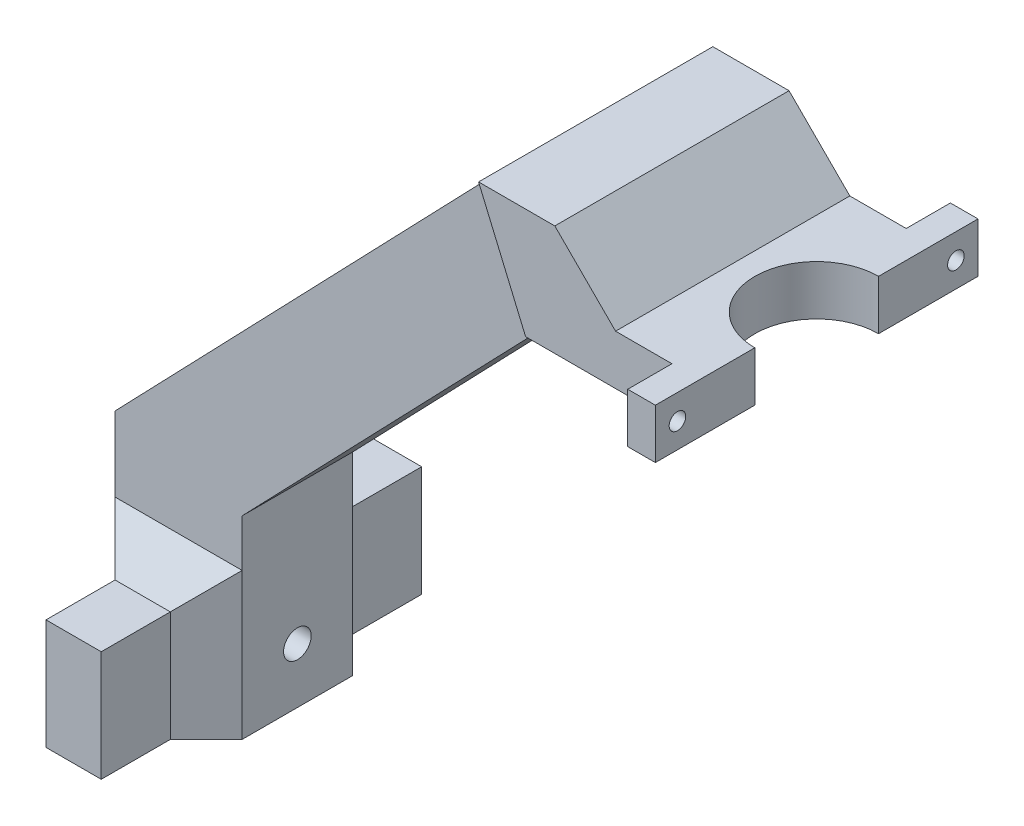
from build123d import *

# Parameters (mm, degrees)
BOSS_EXTRUDE1_DEPTH      = 25.4
BOSS_EXTRUDE4_DEPTH      = 24.13
BOSS_EXTRUDE4_DEPTH_BACK = 49.53
SKETCH7_W                = 12.7
SKETCH7_H                = 25.4
SKETCH8_R                = 3.175
CUT_EXTRUDE3_DEPTH       = 219.535967291
CHAMFER3_SIZE            = 8.255
BOSS_EXTRUDE5_DEPTH      = 14.224
BOSS_EXTRUDE5_DEPTH_BACK = 39.624
SKETCH9_R                = 14.224
CUT_EXTRUDE4_DEPTH       = 188.728167838
SKETCH11_W               = 33.274
SKETCH11_H               = 53.848
CUT_EXTRUDE5_DEPTH       = 13.97
CHAMFER4_SIZE            = 13.97
CHAMFER5_SIZE            = 13.97
SKETCH18_W               = 6.35
SKETCH18_H               = 11.43
BOSS_EXTRUDE6_DEPTH      = 10.16
SKETCH19_W               = 6.35
SKETCH19_H               = 11.43
BOSS_EXTRUDE7_DEPTH      = 10.16
SKETCH20_R               = 1.905
CUT_EXTRUDE7_DEPTH       = 10.16


with BuildPart() as part:
    # Sketch2 → Boss-Extrude1 (new body)
    with BuildSketch(Plane.XY):
        Polygon((0, 0), (50.8, 0), (50.8, -25.4), (10.806439585, -25.4), (-68.58, -107.87941775), (-68.58, -152.4), (-97.79, -152.4), (-97.79, -101.6), align=None)
    extrude(amount=BOSS_EXTRUDE1_DEPTH)

    # Sketch7 → Boss-Extrude4 (add, two sides: drawn at the far end of the back side and taken through both)
    with BuildSketch(Plane.XY.offset(25.4).offset(-BOSS_EXTRUDE4_DEPTH_BACK)):
        with Locations((-83.185, -139.7)):
            Rectangle(SKETCH7_W, SKETCH7_H)
    extrude(amount=BOSS_EXTRUDE4_DEPTH + BOSS_EXTRUDE4_DEPTH_BACK)

    # Sketch8 → Cut-Extrude3 (cut, through all)
    with BuildSketch(Plane.ZY.offset(97.79)):
        with Locations((12.7, -139.7)):
            Circle(SKETCH8_R)
    extrude(amount=-CUT_EXTRUDE3_DEPTH, mode=Mode.SUBTRACT)

    # Chamfer3
    chamfer3_edges = [part.edges().sort_by_distance(p)[0] for p in [
        (-76.835, -139.7, 25.4),
        (-76.835, -139.7, 0),
        (-83.185, -127, 25.4),
        (-83.185, -127, 0),
        (-89.535, -139.7, 25.4),
        (-89.535, -139.7, 0),
    ]]
    chamfer(chamfer3_edges, length=CHAMFER3_SIZE - 0.0001)  # a hair under: the kernel refuses the full size

    # Sketch10 → Boss-Extrude5 (add, two sides: drawn at the far end of the back side and taken through both)
    with BuildSketch(Plane.XY.offset(25.4).offset(-BOSS_EXTRUDE5_DEPTH_BACK)):
        Polygon((0, 0), (10.806439585, -25.4), (50.8, -25.4), (50.8, 0), align=None)
    extrude(amount=BOSS_EXTRUDE5_DEPTH + BOSS_EXTRUDE5_DEPTH_BACK)

    # Sketch9 → Cut-Extrude4 (cut, through all)
    with BuildSketch(Plane(origin=(0, 0, 0), x_dir=(1, 0, 0), z_dir=(0, 1, 0))):
        with Locations((50.8, -12.7)):
            Circle(SKETCH9_R)
    extrude(amount=-CUT_EXTRUDE4_DEPTH, mode=Mode.SUBTRACT)

    # Sketch11 → Cut-Extrude5 (cut)
    with BuildSketch(Plane(origin=(0, 0, 0), x_dir=(1, 0, 0), z_dir=(0, 1, 0))):
        with Locations((34.163, -12.7)):
            Rectangle(SKETCH11_W, SKETCH11_H)
    extrude(amount=-CUT_EXTRUDE5_DEPTH, mode=Mode.SUBTRACT)

    # Chamfer4
    chamfer4_edges = [part.edges().sort_by_distance(p)[0] for p in [
        (17.526, -13.97, 12.7),
    ]]
    chamfer(chamfer4_edges, length=CHAMFER4_SIZE - 0.0001)  # a hair under: the kernel refuses the full size

    # Chamfer5
    chamfer5_edges = [part.edges().sort_by_distance(p)[0] for p in [
        (5.403219792, -12.7, 0),
        (5.403219792, -12.7, 25.4),
    ]]
    chamfer(chamfer5_edges, length=CHAMFER5_SIZE)

    # Sketch18 → Boss-Extrude6 (add)
    with BuildSketch(Plane.XY.offset(39.624)):
        with Locations((47.625, -19.685)):
            Rectangle(SKETCH18_W, SKETCH18_H)
    extrude(amount=BOSS_EXTRUDE6_DEPTH)

    # Sketch19 → Boss-Extrude7 (add)
    with BuildSketch(Plane(origin=(0, 0, -14.224), x_dir=(-1, 0, 0), z_dir=(0, 0, -1))):
        with Locations((-47.625, -19.685)):
            Rectangle(SKETCH19_W, SKETCH19_H)
    extrude(amount=BOSS_EXTRUDE7_DEPTH)

    # Sketch20 → Cut-Extrude7 (cut)
    with BuildSketch(Plane(origin=(50.8, 0, 0), x_dir=(0, 0, -1), z_dir=(1, 0, 0))):
        with Locations((-44.704, -19.685)):
            Circle(SKETCH20_R)
        with Locations((19.304, -19.685)):
            Circle(SKETCH20_R)
    extrude(amount=-CUT_EXTRUDE7_DEPTH, mode=Mode.SUBTRACT)


solid = part.part
